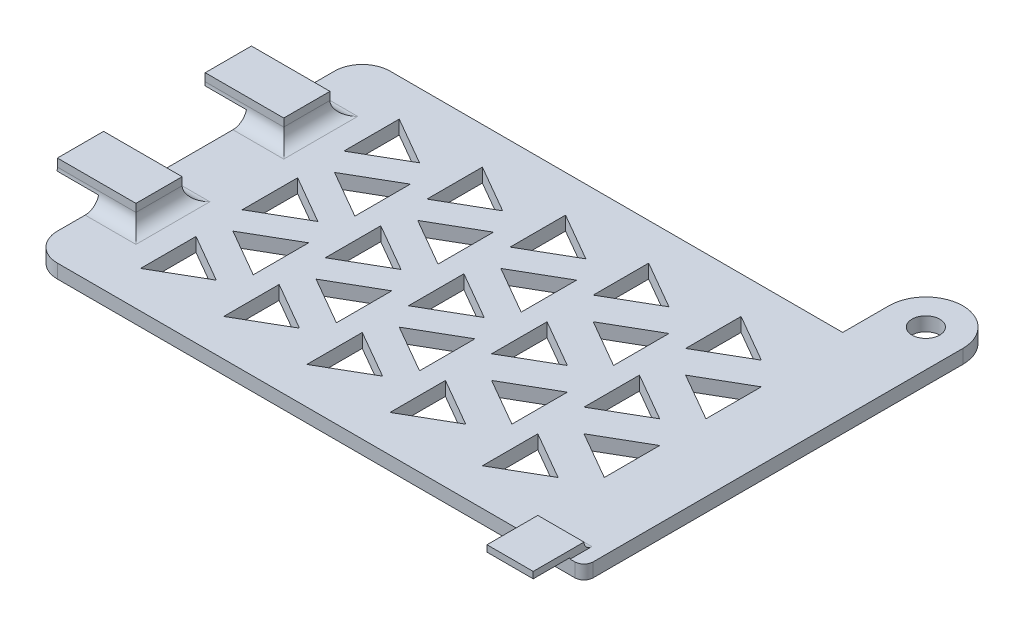
from build123d import *
from OCP.BRepFilletAPI import BRepFilletAPI_MakeFillet

# Parameters (mm, degrees)
SKETCH1_R                = 1.5
BOSS_EXTRUDE1_DEPTH      = 1.5
BOSS_EXTRUDE2_DEPTH      = 2
BOSS_EXTRUDE2_DEPTH_BACK = 1.5
SKETCH3_W                = 5
SKETCH3_H                = 0.7
SKETCH4_W                = 5
SKETCH4_H                = 1.5
BOSS_EXTRUDE3_DEPTH      = 0.15
FILLET2_R                = 0.85
SKETCH5_W                = 5
SKETCH5_H                = 1.2
BOSS_EXTRUDE4_DEPTH      = 2.5
BOSS_EXTRUDE4_2_DEPTH    = 2.5
SKETCH6_W                = 4
SKETCH6_H                = 5
BOSS_EXTRUDE5_DEPTH      = 2.35
FILLET3_R                = 1.5
CUT_EXTRUDE1_DEPTH       = 2.5
FILLET4_R1               = 3
FILLET4_R2               = 1
SKETCH8_W                = 5
SKETCH8_H                = 0.7
BOSS_EXTRUDE6_DEPTH      = 2
BOSS_EXTRUDE7_DEPTH      = 2


with BuildPart() as part:
    # Sketch1 → Boss-Extrude1 (new body)
    with BuildSketch(Plane(origin=(0, 0, 0), x_dir=(1, 0, 0), z_dir=(0, 1, 0))):
        with BuildLine():
            Line((0, 0), (60, 0))
            Line((60, 0), (60, 36))
            Line((60, 36), (60, 41))
            ThreePointArc((60, 41), (56, 45), (52, 41))
            Line((52, 41), (52, 36))
            Line((52, 36), (0, 36))
            Line((0, 36), (0, 0))
        make_face()
        with Locations(Location((56, 41, 0), (0, 0, 270))):
            Circle(SKETCH1_R, mode=Mode.SUBTRACT)
    extrude(amount=BOSS_EXTRUDE1_DEPTH)



with BuildPart() as body_2:
    # Sketch3 → Boss-Extrude2 (new, two sides: drawn at the far end of the back side and taken through both)
    with BuildSketch(Plane.XY.offset(-BOSS_EXTRUDE2_DEPTH_BACK)):
        with Locations((56, 2)):
            Rectangle(SKETCH3_W, SKETCH3_H)
    extrude(amount=BOSS_EXTRUDE2_DEPTH + BOSS_EXTRUDE2_DEPTH_BACK)


with BuildPart() as part_1:
    add(part.part)

    add(body_2.part)  # Boss-Extrude3 merges body 2
    # Sketch4 → Boss-Extrude3 (add)
    with BuildSketch(Plane.XZ.offset(-1.65)):
        with Locations((56, -0.75)):
            Rectangle(SKETCH4_W, SKETCH4_H)
    extrude(amount=BOSS_EXTRUDE3_DEPTH)

    # Fillet2
    fillet2_edges = [part_1.edges().sort_by_distance(p)[0] for p in [
        (56, 1.5, -1.5),
    ]]
    fillet(fillet2_edges, radius=FILLET2_R - 0.0001)  # a hair under: the kernel refuses the full size



with BuildPart() as body_2_2:
    # Sketch5 → Boss-Extrude4 (new body)
    with BuildSketch(Plane.ZY):
        with Locations((-10, 3.25)):
            Rectangle(SKETCH5_W, SKETCH5_H)
    extrude(amount=BOSS_EXTRUDE4_DEPTH)


with BuildPart() as body_3:
    # Sketch5 → Boss-Extrude4 2 (new body)
    with BuildSketch(Plane.ZY):
        with Locations((-26, 3.25)):
            Rectangle(SKETCH5_W, SKETCH5_H)
    extrude(amount=BOSS_EXTRUDE4_2_DEPTH)


with BuildPart() as part_2:
    add(part_1.part)

    add(body_2_2.part)  # Boss-Extrude5 merges body 2 2

    add(body_3.part)  # Boss-Extrude5 merges body 3
    # Sketch6 → Boss-Extrude5 (add)
    with BuildSketch(Plane(origin=(0, 1.5, 0), x_dir=(1, 0, 0), z_dir=(0, 1, 0))):
        with Locations((2, 26)):
            Rectangle(SKETCH6_W, SKETCH6_H)
        with Locations((2, 10)):
            Rectangle(SKETCH6_W, SKETCH6_H)
    extrude(amount=BOSS_EXTRUDE5_DEPTH)

    # Fillet3
    fillet3_edges = [part_2.edges().sort_by_distance(p)[0] for p in [
        (2, 1.5, -7.5),
    ]]
    fillet(fillet3_edges, radius=FILLET3_R)
    fillet3_2_edges = [part_2.edges().sort_by_distance(p)[0] for p in [
        (4, 1.5, -10),
    ]]
    fillet(fillet3_2_edges, radius=FILLET3_R)
    fillet3_3_edges = [part_2.edges().sort_by_distance(p)[0] for p in [
        (2, 1.5, -12.5),
    ]]
    fillet(fillet3_3_edges, radius=FILLET3_R)
    fillet3_4_edges = [part_2.edges().sort_by_distance(p)[0] for p in [
        (2, 1.5, -23.5),
    ]]
    fillet(fillet3_4_edges, radius=FILLET3_R)
    fillet3_5_edges = [part_2.edges().sort_by_distance(p)[0] for p in [
        (4, 1.5, -26),
    ]]
    fillet(fillet3_5_edges, radius=FILLET3_R - 0.0001)  # a hair under: the kernel refuses the full size
    fillet3_6_edges = [part_2.edges().sort_by_distance(p)[0] for p in [
        (2, 1.5, -28.5),
    ]]
    fillet(fillet3_6_edges, radius=FILLET3_R - 0.0001)  # a hair under: the kernel refuses the full size

    # Sketch7 → Cut-Extrude1 (cut)
    with BuildSketch(Plane(origin=(0, 1.5, 0), x_dir=(1, 0, 0), z_dir=(0, 1, 0))):
        Polygon((13.196152423, 29), (8, 32), (8, 26), align=None)
        Polygon((17, 26), (22.196152423, 29), (17, 32), align=None)
        Polygon((26, 26), (31.196152423, 29), (26, 32), align=None)
        Polygon((35, 26), (40.196152423, 29), (35, 32), align=None)
        Polygon((13.196152423, 18), (8, 21), (8, 15), align=None)
        Polygon((17, 15), (22.196152423, 18), (17, 21), align=None)
        Polygon((26, 15), (31.196152423, 18), (26, 21), align=None)
        Polygon((35, 15), (40.196152423, 18), (35, 21), align=None)
        Polygon((13.196152423, 7), (8, 10), (8, 4), align=None)
        Polygon((17, 4), (22.196152423, 7), (17, 10), align=None)
        Polygon((26, 4), (31.196152423, 7), (26, 10), align=None)
        Polygon((35, 4), (40.196152423, 7), (35, 10), align=None)
        Polygon((9.5, 23.5), (14.696152423, 26.5), (14.696152423, 20.5), align=None)
        Polygon((23.696152423, 20.5), (18.5, 23.5), (23.696152423, 26.5), align=None)
        Polygon((32.696152423, 20.5), (27.5, 23.5), (32.696152423, 26.5), align=None)
        Polygon((14.696152423, 9.5), (9.5, 12.5), (14.696152423, 15.5), align=None)
        Polygon((18.5, 12.5), (23.696152423, 15.5), (23.696152423, 9.5), align=None)
        Polygon((32.696152423, 9.5), (27.5, 12.5), (32.696152423, 15.5), align=None)
        Polygon((45, 26), (50.196152423, 29), (45, 32), align=None)
        Polygon((45, 15), (50.196152423, 18), (45, 21), align=None)
        Polygon((45, 4), (50.196152423, 7), (45, 10), align=None)
        Polygon((42.696152423, 20.5), (37.5, 23.5), (42.696152423, 26.5), align=None)
        Polygon((42.696152423, 9.5), (37.5, 12.5), (42.696152423, 15.5), align=None)
        Polygon((52.696152423, 20.5), (47.5, 23.5), (52.696152423, 26.5), align=None)
        Polygon((52.696152423, 9.5), (47.5, 12.5), (52.696152423, 15.5), align=None)
    extrude(amount=-CUT_EXTRUDE1_DEPTH, mode=Mode.SUBTRACT)

    # Fillet4: one fillet with a radius per group of edges: ONE call of the kernel's fillet builder (fillet() takes one radius for all edges)
    fillet4_edges_1 = [part_2.edges().sort_by_distance(p)[0] for p in [
        (0, 0.75, 0),
        (0, 0.75, -36),
    ]]
    fillet4_edges_2 = [part_2.edges().sort_by_distance(p)[0] for p in [
        (60, 0.75, 0),
    ]]
    fillet4 = BRepFilletAPI_MakeFillet(part_2.part.solid().wrapped)
    for e in fillet4_edges_1:
        fillet4.Add(FILLET4_R1, e.wrapped)
    for e in fillet4_edges_2:
        fillet4.Add(FILLET4_R2, e.wrapped)
    add(Compound.cast(fillet4.Shape()), mode=Mode.REPLACE)

    # Sketch8 → Boss-Extrude6 (add)
    with BuildSketch(Plane.XY.offset(2)):
        with Locations((56, 2)):
            Rectangle(SKETCH8_W, SKETCH8_H)
    extrude(amount=BOSS_EXTRUDE6_DEPTH)

    # Sketch9 → Boss-Extrude7 (add)
    with BuildSketch(Plane.ZY.offset(2.5)):
        with BuildLine():
            Line((-28.541404785, 2.65), (-23.458595215, 2.65))
            ThreePointArc((-23.458595215, 2.65), (-23.489612839, 2.823779714), (-23.5, 3))
            Line((-23.5, 3), (-23.5, 3.85))
            Line((-23.5, 3.85), (-28.5, 3.85))
            Line((-28.5, 3.85), (-28.5, 3))
            ThreePointArc((-28.5, 3), (-28.510387161, 2.823779714), (-28.541404785, 2.65))
        make_face()
        with BuildLine():
            Line((-12.541404785, 2.65), (-7.458595215, 2.65))
            ThreePointArc((-7.458595215, 2.65), (-7.489612839, 2.823779714), (-7.5, 3))
            Line((-7.5, 3), (-7.5, 3.85))
            Line((-7.5, 3.85), (-12.5, 3.85))
            Line((-12.5, 3.85), (-12.5, 3))
            ThreePointArc((-12.5, 3), (-12.510387161, 2.823779714), (-12.541404785, 2.65))
        make_face()
    extrude(amount=BOSS_EXTRUDE7_DEPTH)


solid = part_2.part
